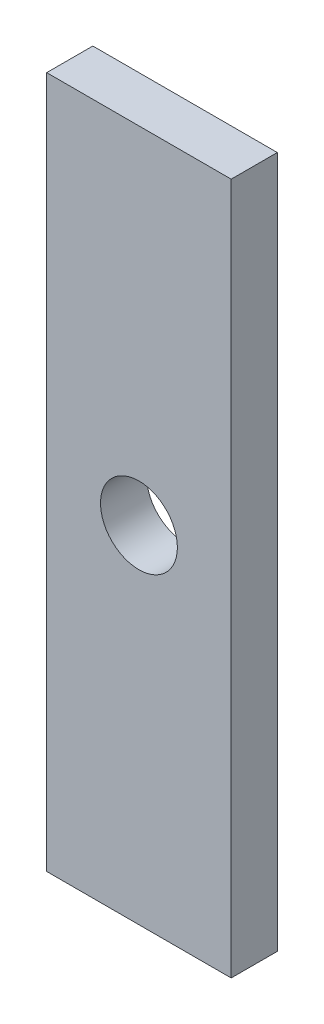
from build123d import *

# Parameters (mm, degrees)
SKETCH1_W           = 45
SKETCH1_H           = 12
SKETCH1_R           = 2.5
BOSS_EXTRUDE1_DEPTH = 3


with BuildPart() as part:
    # Sketch1 → Boss-Extrude1 (new body)
    with BuildSketch(Plane(origin=(0, 0, 0), x_dir=(0, 1, 0), z_dir=(0, 0, 1))):
        Rectangle(SKETCH1_W, SKETCH1_H)
        Circle(SKETCH1_R, mode=Mode.SUBTRACT)
    extrude(amount=BOSS_EXTRUDE1_DEPTH)


solid = part.part
